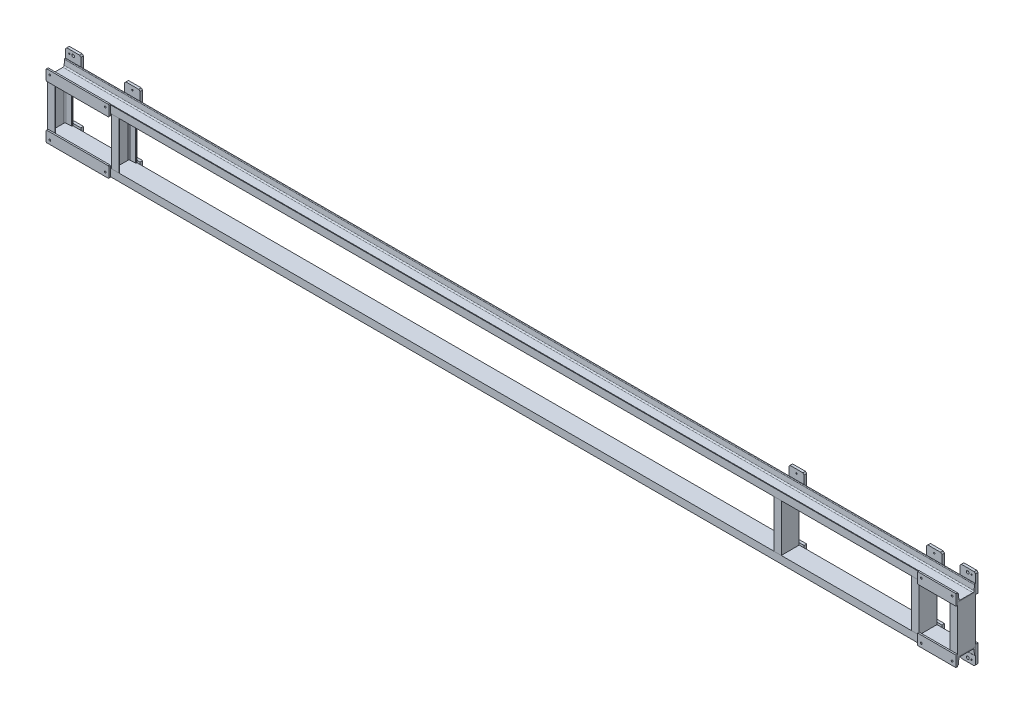
from build123d import *

# Parameters (mm, degrees)
MEMBER_1_DEPTH               = 7100
MEMBER_3_DEPTH               = 370
PATTERN_LINEAR_2_COUNT       = 2
PATTERN_LINEAR_2_PITCH       = 300
SKETCH_9_W                   = 120
SKETCH_9_H                   = 150
EXTRUDE_1_DEPTH              = 20
SKETCH_10_W                  = 120
SKETCH_10_H                  = 150
EXTRUDE_2_DEPTH              = 20
EXTRUDE_2_2_DEPTH            = 20
EXTRUDE_2_3_DEPTH            = 20
HOLE_WIZARD_M12_1_AT_2_COUNT = 2
HOLE_WIZARD_M12_1_AT_2_PITCH = 491.5
HOLE_WIZARD_M12_1_AT_3_COUNT = 2
HOLE_WIZARD_M12_1_AT_3_PITCH = 6748.5
HOLE_WIZARD_M12_1_AT_4_COUNT = 2
HOLE_WIZARD_M12_1_AT_4_PITCH = 7040
HOLE_WIZARD_M12_1_AT_5_COUNT = 2
HOLE_WIZARD_M12_1_AT_5_PITCH = 7063.524332796
HOLE_WIZARD_M12_1_AT_6_COUNT = 2
HOLE_WIZARD_M12_1_AT_6_PITCH = 6773.036855798
HOLE_WIZARD_M12_1_AT_7_COUNT = 2
HOLE_WIZARD_M12_1_AT_7_PITCH = 757.19762942
HOLE_WIZARD_M12_1_AT_8_COUNT = 2
HOLE_WIZARD_M12_1_AT_8_PITCH = 576
SKETCH_14_W                  = 492
SKETCH_14_H                  = 85
EXTRUDE_3_DEPTH              = 12
HOLE_WIZARD_M16_1_AT_2_COUNT = 2
HOLE_WIZARD_M16_1_AT_2_PITCH = 432
CHAMFER_1_SIZE               = 5
CHAMFER_2_SIZE               = 5
CHAMFER_3_SIZE               = 10
CHAMFER_4_SIZE               = 10
CHAMFER_5_SIZE               = 10
CHAMFER_6_SIZE               = 10
CHAMFER_7_SIZE               = 10
CHAMFER_8_SIZE               = 10
CHAMFER_9_SIZE               = 10
CHAMFER_10_SIZE              = 10
SKETCH_17_W                  = 300
SKETCH_17_H                  = 85
EXTRUDE_4_DEPTH              = 12
EXTRUDE_4_2_DEPTH            = 12
MEMBER_4_DEPTH               = 370
PATTERN_LINEAR_3_COUNT       = 2
PATTERN_LINEAR_3_PITCH       = 500
PATTERN_LINEAR_4_COUNT       = 2
PATTERN_LINEAR_4_PITCH       = 1075
PATTERN_LINEAR_5_COUNT       = 2
PATTERN_LINEAR_5_PITCH       = 1075
SKETCH_30_R                  = 11
CUT_EXTRUDE_4_DEPTH          = 7120.418023968
HOLE_WIZARD_M16_3_AT_2_COUNT = 2
HOLE_WIZARD_M16_3_AT_2_PITCH = 240
HOLE_WIZARD_M16_3_AT_3_COUNT = 2
HOLE_WIZARD_M16_3_AT_3_PITCH = 501.198563446
HOLE_WIZARD_M16_3_AT_4_COUNT = 2
HOLE_WIZARD_M16_3_AT_4_PITCH = 440


# Read off the part's stored shape, not the designer's step: 结构构件1
with BuildPart() as part:
    # Member 1 outline → Member 1 (new body)
    with BuildSketch(Plane.YZ):
        with BuildLine():
            Line((370, 0), (370, -140))
            Line((370, -140), (428, -140))
            Line((428, -140), (428, -136.774893301))
            ThreePointArc((428, -136.774893301), (426.711929381, -133.522579516), (423.546296859, -132.034143554))
            Line((423.546296859, -132.034143554), (384.907406282, -129.619212893))
            ThreePointArc((384.907406282, -129.619212893), (378.576141238, -126.642340968), (376, -120.137713397))
            Line((376, -120.137713397), (376, -19.862286603))
            ThreePointArc((376, -19.862286603), (378.576141238, -13.357659032), (384.907406282, -10.380787107))
            Line((384.907406282, -10.380787107), (423.546296859, -7.965856446))
            ThreePointArc((423.546296859, -7.965856446), (426.711929381, -6.477420484), (428, -3.225106699))
            Line((428, -3.225106699), (428, 0))
            Line((428, 0), (370, 0))
        make_face()
        with BuildLine():
            Line((-58, -140), (0, -140))
            Line((0, -140), (0, 0))
            Line((0, 0), (-58, 0))
            Line((-58, 0), (-58, -3.225106699))
            ThreePointArc((-58, -3.225106699), (-56.711929381, -6.477420484), (-53.546296859, -7.965856446))
            Line((-53.546296859, -7.965856446), (-14.907406282, -10.380787107))
            ThreePointArc((-14.907406282, -10.380787107), (-8.576141238, -13.357659032), (-6, -19.862286603))
            Line((-6, -19.862286603), (-6, -120.137713397))
            ThreePointArc((-6, -120.137713397), (-8.576141238, -126.642340968), (-14.907406282, -129.619212893))
            Line((-14.907406282, -129.619212893), (-53.546296859, -132.034143554))
            ThreePointArc((-53.546296859, -132.034143554), (-56.711929381, -133.522579516), (-58, -136.774893301))
            Line((-58, -136.774893301), (-58, -140))
        make_face()
    extrude(amount=MEMBER_1_DEPTH)


with BuildPart() as body_2:
    # Sketch1 → Member 3 (new body)
    with BuildSketch(Plane(origin=(7100, 370, -140), x_dir=(1, 0, 0), z_dir=(0, 1, 0))):
        with BuildLine():
            Line((0, 0), (0, -140))
            Line((0, -140), (-58, -140))
            Line((-58, -140), (-58, -136.774893301))
            ThreePointArc((-58, -136.774893301), (-56.711929381, -133.522579516), (-53.546296859, -132.034143554))
            Line((-53.546296859, -132.034143554), (-14.907406282, -129.619212893))
            ThreePointArc((-14.907406282, -129.619212893), (-8.576141238, -126.642340968), (-6, -120.137713397))
            Line((-6, -120.137713397), (-6, -19.862286603))
            ThreePointArc((-6, -19.862286603), (-8.576141238, -13.357659032), (-14.907406282, -10.380787107))
            Line((-14.907406282, -10.380787107), (-53.546296859, -7.965856446))
            ThreePointArc((-53.546296859, -7.965856446), (-56.711929381, -6.477420484), (-58, -3.225106699))
            Line((-58, -3.225106699), (-58, 0))
            Line((-58, 0), (0, 0))
        make_face()
    extrude(amount=-MEMBER_3_DEPTH)


with BuildPart() as pattern_linear_2_1:
    # 阵列(线性)2: pattern copy
    add(body_2.part.moved(Location(Vector(-1, 0, 0) * (1 * PATTERN_LINEAR_2_PITCH))))


with BuildPart() as body_4:
    # 草图9 → 凸台-拉伸1 (new body)
    with BuildSketch(Plane(origin=(0, 0, -140), x_dir=(-1, 0, 0), z_dir=(0, 0, -1))):
        with Locations((-7040, -58)):
            Rectangle(SKETCH_9_W, SKETCH_9_H)
    extrude(amount=EXTRUDE_1_DEPTH)


with BuildPart() as body_5:
    # 草图10 → 凸台-拉伸2 (new body)
    with BuildSketch(Plane(origin=(0, 0, -140), x_dir=(-1, 0, 0), z_dir=(0, 0, -1))):
        with Locations((-6778.5, -58)):
            Rectangle(SKETCH_10_W, SKETCH_10_H)
    extrude(amount=EXTRUDE_2_DEPTH)


with BuildPart() as body_6:
    # 草图10 → Extrude 2 2 (new body)
    with BuildSketch(Plane(origin=(0, 0, -140), x_dir=(-1, 0, 0), z_dir=(0, 0, -1))):
        with Locations((-521.5, -58)):
            Rectangle(SKETCH_10_W, SKETCH_10_H)
    extrude(amount=EXTRUDE_2_2_DEPTH)


with BuildPart() as body_7:
    # 草图10 → Extrude 2 3 (new body)
    with BuildSketch(Plane(origin=(0, 0, -140), x_dir=(-1, 0, 0), z_dir=(0, 0, -1))):
        with Locations((-60, -58)):
            Rectangle(SKETCH_10_W, SKETCH_10_H)
    extrude(amount=EXTRUDE_2_3_DEPTH)


with BuildPart() as body_8:
    # 镜向1: mirrored copy
    add(body_7.part.mirror(Plane.ZX.offset(185)))

    # 草图12 → M12 螺纹孔1 (revolve, cut)
    with BuildSketch(Plane(origin=(30, 473, -140), x_dir=(0, -1, 0), z_dir=(1, 0, 0))):
        Polygon((0, 0), (0, 32.314389157), (5.1, 29.25), (5.1, 0), align=None)
    hole_wizard_m12_1 = revolve(axis=Axis((30, 473, -133.65), (0, 0, -1)), mode=Mode.SUBTRACT)

    # 倒角10
    chamfer_10_edges = [body_8.edges().sort_by_distance(p)[0] for p in [
        (0, 503, -150),
        (120, 503, -150),
    ]]
    chamfer(chamfer_10_edges, length=CHAMFER_10_SIZE)


with BuildPart() as body_9:
    # Mirror 1 2: mirrored copy
    add(body_6.part.mirror(Plane.ZX.offset(185)))

    # M12 螺纹孔1 at 2: M12 螺纹孔1 ×2
    with Locations(*[(i * HOLE_WIZARD_M12_1_AT_2_PITCH, 0, 0) for i in range(1, HOLE_WIZARD_M12_1_AT_2_COUNT)]):
        add(hole_wizard_m12_1, mode=Mode.SUBTRACT)

    # 倒角9
    chamfer_9_edges = [body_9.edges().sort_by_distance(p)[0] for p in [
        (461.5, 503, -150),
        (581.5, 503, -150),
    ]]
    chamfer(chamfer_9_edges, length=CHAMFER_9_SIZE)


with BuildPart() as body_10:
    # Mirror 1 3: mirrored copy
    add(body_5.part.mirror(Plane.ZX.offset(185)))

    # M12 螺纹孔1 at 3: M12 螺纹孔1 ×2
    with Locations(*[(i * HOLE_WIZARD_M12_1_AT_3_PITCH, 0, 0) for i in range(1, HOLE_WIZARD_M12_1_AT_3_COUNT)]):
        add(hole_wizard_m12_1, mode=Mode.SUBTRACT)

    # 倒角8
    chamfer_8_edges = [body_10.edges().sort_by_distance(p)[0] for p in [
        (6718.5, 503, -150),
        (6838.5, 503, -150),
    ]]
    chamfer(chamfer_8_edges, length=CHAMFER_8_SIZE)


with BuildPart() as body_11:
    # Mirror 1 4: mirrored copy
    add(body_4.part.mirror(Plane.ZX.offset(185)))

    # M12 螺纹孔1 at 4: M12 螺纹孔1 ×2
    with Locations(*[(i * HOLE_WIZARD_M12_1_AT_4_PITCH, 0, 0) for i in range(1, HOLE_WIZARD_M12_1_AT_4_COUNT)]):
        add(hole_wizard_m12_1, mode=Mode.SUBTRACT)

    # 倒角7
    chamfer_7_edges = [body_11.edges().sort_by_distance(p)[0] for p in [
        (6980, 503, -150),
        (7100, 503, -150),
    ]]
    chamfer(chamfer_7_edges, length=CHAMFER_7_SIZE)


with BuildPart() as body_4_1:
    add(body_4.part)

    # M12 螺纹孔1 at 5: M12 螺纹孔1 ×2
    with Locations(*[Vector(0.9966696040549201, -0.08154569487722073, 0) * (i * HOLE_WIZARD_M12_1_AT_5_PITCH) for i in range(1, HOLE_WIZARD_M12_1_AT_5_COUNT)]):
        add(hole_wizard_m12_1, mode=Mode.SUBTRACT)

    # 倒角6
    chamfer_6_edges = [body_4_1.edges().sort_by_distance(p)[0] for p in [
        (6980, -133, -150),
        (7100, -133, -150),
    ]]
    chamfer(chamfer_6_edges, length=CHAMFER_6_SIZE)


with BuildPart() as body_5_1:
    add(body_5.part)

    # M12 螺纹孔1 at 6: M12 螺纹孔1 ×2
    with Locations(*[Vector(0.996377274135584, -0.08504309252457529, 0) * (i * HOLE_WIZARD_M12_1_AT_6_PITCH) for i in range(1, HOLE_WIZARD_M12_1_AT_6_COUNT)]):
        add(hole_wizard_m12_1, mode=Mode.SUBTRACT)

    # 倒角5
    chamfer_5_edges = [body_5_1.edges().sort_by_distance(p)[0] for p in [
        (6718.5, -133, -150),
        (6838.5, -133, -150),
    ]]
    chamfer(chamfer_5_edges, length=CHAMFER_5_SIZE)


with BuildPart() as body_6_1:
    add(body_6.part)

    # M12 螺纹孔1 at 7: M12 螺纹孔1 ×2
    with Locations(*[Vector(0.6491039867308706, -0.7606996873997584, 0) * (i * HOLE_WIZARD_M12_1_AT_7_PITCH) for i in range(1, HOLE_WIZARD_M12_1_AT_7_COUNT)]):
        add(hole_wizard_m12_1, mode=Mode.SUBTRACT)

    # 倒角4
    chamfer_4_edges = [body_6_1.edges().sort_by_distance(p)[0] for p in [
        (461.5, -133, -150),
        (581.5, -133, -150),
    ]]
    chamfer(chamfer_4_edges, length=CHAMFER_4_SIZE)


with BuildPart() as body_7_1:
    add(body_7.part)

    # M12 螺纹孔1 at 8: M12 螺纹孔1 ×2
    with Locations(*[(0, -i * HOLE_WIZARD_M12_1_AT_8_PITCH, 0) for i in range(1, HOLE_WIZARD_M12_1_AT_8_COUNT)]):
        add(hole_wizard_m12_1, mode=Mode.SUBTRACT)

    # 倒角3
    chamfer_3_edges = [body_7_1.edges().sort_by_distance(p)[0] for p in [
        (0, -133, -150),
        (120, -133, -150),
    ]]
    chamfer(chamfer_3_edges, length=CHAMFER_3_SIZE)


with BuildPart() as body_12:
    # 草图14 → 凸台-拉伸3 (new body)
    with BuildSketch(Plane.XY):
        with Locations((246, -22.5)):
            Rectangle(SKETCH_14_W, SKETCH_14_H)
    extrude(amount=EXTRUDE_3_DEPTH)


with BuildPart() as hole_wizard_m16_1_tool:
    # 草图15 → M16 螺纹孔1 (revolve)
    with BuildSketch(Plane(origin=(30, -35, 12), x_dir=(0, -1, 0), z_dir=(1, 0, 0))):
        Polygon((0, 0), (0, 42.206024333), (7, 38), (7, 0), align=None)
    hole_wizard_m16_1 = revolve(axis=Axis((30, -35, 18.35), (0, 0, -1)))


with BuildPart() as part_1:
    add(part.part)

    # M16 螺纹孔1: cut by hole_wizard_m16_1_tool
    add(hole_wizard_m16_1_tool.part, mode=Mode.SUBTRACT)


with BuildPart() as body_12_1:
    add(body_12.part)

    # M16 螺纹孔1: cut by hole_wizard_m16_1_tool
    add(hole_wizard_m16_1_tool.part, mode=Mode.SUBTRACT)


with BuildPart() as hole_wizard_m16_1_at_2_tool:
    # M16 螺纹孔1 at 2: M16 螺纹孔1 ×2
    with Locations(*[(i * HOLE_WIZARD_M16_1_AT_2_PITCH, 0, 0) for i in range(1, HOLE_WIZARD_M16_1_AT_2_COUNT)]):
        add(hole_wizard_m16_1)


with BuildPart() as part_2:
    add(part_1.part)

    # M16 螺纹孔1 at 2: cut by hole_wizard_m16_1_at_2_tool
    add(hole_wizard_m16_1_at_2_tool.part, mode=Mode.SUBTRACT)


with BuildPart() as body_12_2:
    add(body_12_1.part)

    # M16 螺纹孔1 at 2: cut by hole_wizard_m16_1_at_2_tool
    add(hole_wizard_m16_1_at_2_tool.part, mode=Mode.SUBTRACT)


with BuildPart() as body_13:
    # 镜向3: mirrored copy
    add(body_12_2.part.mirror(Plane.ZX.offset(185)))

    # 倒角1
    chamfer_1_edges = [body_13.edges().sort_by_distance(p)[0] for p in [
        (492, 435, 6),
        (0, 435, 6),
        (0, 350, 6),
        (492, 350, 6),
    ]]
    chamfer(chamfer_1_edges, length=CHAMFER_1_SIZE)


with BuildPart() as body_12_3:
    add(body_12_2.part)

    # 倒角2
    chamfer_2_edges = [body_12_3.edges().sort_by_distance(p)[0] for p in [
        (492, -65, 6),
        (0, -65, 6),
        (0, 20, 6),
        (492, 20, 6),
    ]]
    chamfer(chamfer_2_edges, length=CHAMFER_2_SIZE)


with BuildPart() as body_14:
    # 草图17 → 凸台-拉伸4 (new body)
    with BuildSketch(Plane.XY):
        with Locations((6950, 392.5)):
            Rectangle(SKETCH_17_W, SKETCH_17_H)
    extrude(amount=EXTRUDE_4_DEPTH)


with BuildPart() as body_15:
    # 草图17 → Extrude 4 2 (new body)
    with BuildSketch(Plane.XY):
        with Locations((6950, -22.5)):
            Rectangle(SKETCH_17_W, SKETCH_17_H)
    extrude(amount=EXTRUDE_4_2_DEPTH)


with BuildPart() as body_16:
    # Sketch16 → Member 4 (new body)
    with BuildSketch(Plane(origin=(0, 370, 0), x_dir=(-1, 0, 0), z_dir=(0, 1, 0))):
        with BuildLine():
            Line((0, 0), (0, -140))
            Line((0, -140), (-58, -140))
            Line((-58, -140), (-58, -136.774893301))
            ThreePointArc((-58, -136.774893301), (-56.711929381, -133.522579516), (-53.546296859, -132.034143554))
            Line((-53.546296859, -132.034143554), (-14.907406282, -129.619212893))
            ThreePointArc((-14.907406282, -129.619212893), (-8.576141238, -126.642340968), (-6, -120.137713397))
            Line((-6, -120.137713397), (-6, -19.862286603))
            ThreePointArc((-6, -19.862286603), (-8.576141238, -13.357659032), (-14.907406282, -10.380787107))
            Line((-14.907406282, -10.380787107), (-53.546296859, -7.965856446))
            ThreePointArc((-53.546296859, -7.965856446), (-56.711929381, -6.477420484), (-58, -3.225106699))
            Line((-58, -3.225106699), (-58, 0))
            Line((-58, 0), (0, 0))
        make_face()
    extrude(amount=-MEMBER_4_DEPTH)


with BuildPart() as pattern_linear_3_1:
    # 阵列(线性)3: pattern copy
    add(body_16.part.moved(Location(Vector(1, 0, 0) * (1 * PATTERN_LINEAR_3_PITCH))))


with BuildPart() as pattern_linear_4_1:
    # 阵列(线性)4: pattern copy
    add(body_10.part.moved(Location(Vector(-1, 0, 0) * (1 * PATTERN_LINEAR_4_PITCH))))


with BuildPart() as pattern_linear_4_2:
    # 阵列(线性)4: pattern copy
    add(body_5_1.part.moved(Location(Vector(-1, 0, 0) * (1 * PATTERN_LINEAR_4_PITCH))))


with BuildPart() as pattern_linear_5_1:
    # 阵列(线性)5: pattern copy
    add(pattern_linear_2_1.part.moved(Location(Vector(-1, 0, 0) * (1 * PATTERN_LINEAR_5_PITCH))))


with BuildPart() as cut_extrude_4_tool:
    # 草图30 → 切除-拉伸4 (new, through all)
    with BuildSketch(Plane.XY.offset(-140)):
        with Locations((60, 473)):
            Circle(SKETCH_30_R)
        with Locations((60, -103)):
            Circle(SKETCH_30_R)
        with Locations((7040, 473)):
            Circle(SKETCH_30_R)
        with Locations((7040, -103)):
            Circle(SKETCH_30_R)
    extrude(amount=-CUT_EXTRUDE_4_DEPTH)


with BuildPart() as body_4_2:
    add(body_4_1.part)

    # 切除-拉伸4: cut by cut_extrude_4_tool
    add(cut_extrude_4_tool.part, mode=Mode.SUBTRACT)


with BuildPart() as body_7_2:
    add(body_7_1.part)

    # 切除-拉伸4: cut by cut_extrude_4_tool
    add(cut_extrude_4_tool.part, mode=Mode.SUBTRACT)


with BuildPart() as body_8_1:
    add(body_8.part)

    # 切除-拉伸4: cut by cut_extrude_4_tool
    add(cut_extrude_4_tool.part, mode=Mode.SUBTRACT)


with BuildPart() as body_11_1:
    add(body_11.part)

    # 切除-拉伸4: cut by cut_extrude_4_tool
    add(cut_extrude_4_tool.part, mode=Mode.SUBTRACT)


with BuildPart() as hole_wizard_m16_3_tool:
    # 草图33 → M16 螺纹孔3 (revolve)
    with BuildSketch(Plane(origin=(7070, -35, 12), x_dir=(0, -1, 0), z_dir=(1, 0, 0))):
        Polygon((0, 0), (0, 42.206024333), (7, 38), (7, 0), align=None)
    hole_wizard_m16_3 = revolve(axis=Axis((7070, -35, 18.35), (0, 0, -1)))


with BuildPart() as part_3:
    add(part_2.part)

    # M16 螺纹孔3: cut by hole_wizard_m16_3_tool
    add(hole_wizard_m16_3_tool.part, mode=Mode.SUBTRACT)


with BuildPart() as body_15_1:
    add(body_15.part)

    # M16 螺纹孔3: cut by hole_wizard_m16_3_tool
    add(hole_wizard_m16_3_tool.part, mode=Mode.SUBTRACT)


with BuildPart() as hole_wizard_m16_3_at_2_tool:
    # M16 螺纹孔3 at 2: M16 螺纹孔3 ×2
    with Locations(*[(-i * HOLE_WIZARD_M16_3_AT_2_PITCH, 0, 0) for i in range(1, HOLE_WIZARD_M16_3_AT_2_COUNT)]):
        add(hole_wizard_m16_3)


with BuildPart() as part_4:
    add(part_3.part)

    # M16 螺纹孔3 at 2: cut by hole_wizard_m16_3_at_2_tool
    add(hole_wizard_m16_3_at_2_tool.part, mode=Mode.SUBTRACT)


with BuildPart() as body_15_2:
    add(body_15_1.part)

    # M16 螺纹孔3 at 2: cut by hole_wizard_m16_3_at_2_tool
    add(hole_wizard_m16_3_at_2_tool.part, mode=Mode.SUBTRACT)


with BuildPart() as hole_wizard_m16_3_at_3_tool:
    # M16 螺纹孔3 at 3: M16 螺纹孔3 ×2
    with Locations(*[Vector(-0.478852130680572, 0.8778955729143851, 0) * (i * HOLE_WIZARD_M16_3_AT_3_PITCH) for i in range(1, HOLE_WIZARD_M16_3_AT_3_COUNT)]):
        add(hole_wizard_m16_3)


with BuildPart() as part_5:
    add(part_4.part)

    # M16 螺纹孔3 at 3: cut by hole_wizard_m16_3_at_3_tool
    add(hole_wizard_m16_3_at_3_tool.part, mode=Mode.SUBTRACT)


with BuildPart() as body_14_1:
    add(body_14.part)

    # M16 螺纹孔3 at 3: cut by hole_wizard_m16_3_at_3_tool
    add(hole_wizard_m16_3_at_3_tool.part, mode=Mode.SUBTRACT)


with BuildPart() as hole_wizard_m16_3_at_4_tool:
    # M16 螺纹孔3 at 4: M16 螺纹孔3 ×2
    with Locations(*[(0, i * HOLE_WIZARD_M16_3_AT_4_PITCH, 0) for i in range(1, HOLE_WIZARD_M16_3_AT_4_COUNT)]):
        add(hole_wizard_m16_3)


with BuildPart() as part_6:
    add(part_5.part)

    # M16 螺纹孔3 at 4: cut by hole_wizard_m16_3_at_4_tool
    add(hole_wizard_m16_3_at_4_tool.part, mode=Mode.SUBTRACT)


with BuildPart() as body_14_2:
    add(body_14_1.part)

    # M16 螺纹孔3 at 4: cut by hole_wizard_m16_3_at_4_tool
    add(hole_wizard_m16_3_at_4_tool.part, mode=Mode.SUBTRACT)


solid = Compound([body_2.part, pattern_linear_2_1.part, body_9.part, body_10.part, body_5_1.part, body_6_1.part, body_13.part, body_12_3.part, body_16.part, pattern_linear_3_1.part, pattern_linear_4_1.part, pattern_linear_4_2.part, pattern_linear_5_1.part, body_4_2.part, body_7_2.part, body_8_1.part, body_11_1.part, body_15_2.part, part_6.part, body_14_2.part])
